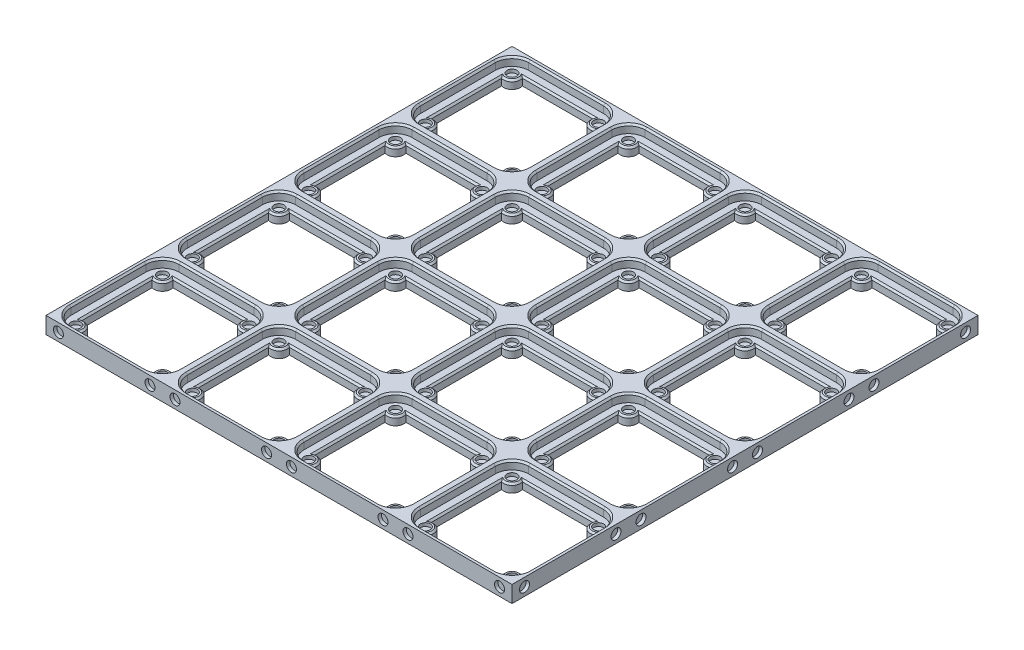
from build123d import *

# Parameters (mm, degrees)
SKETCH1_W           = 70
SKETCH1_H           = 70
BOSS_EXTRUDE2_DEPTH = 7
CUT_EXTRUDE1_DEPTH  = 5
SKETCH9_W           = 70
SKETCH9_H           = 70
BOSS_EXTRUDE3_DEPTH = 5
CUT_EXTRUDE11_DEPTH = 100.242128151
SKETCH21_R          = 3
CUT_EXTRUDE12_DEPTH = 2
CHAMFER3_SIZE       = 1
CUT_EXTRUDE13_START = -2
SKETCH22_W          = 70
SKETCH22_H          = 70
CUT_EXTRUDE13_DEPTH = 2
SKETCH23_R          = 3
CUT_EXTRUDE14_DEPTH = 2
SKETCH24_R          = 3
CUT_EXTRUDE15_DEPTH = 2
SKETCH25_R          = 3
BOSS_EXTRUDE4_DEPTH = 2


with BuildPart() as part:
    # Sketch1 → Boss-Extrude2 (new body)
    with BuildSketch(Plane(origin=(0, 0, 0), x_dir=(1, 0, 0), z_dir=(0, 1, 0))):
        with Locations((35, 35)):
            Rectangle(SKETCH1_W, SKETCH1_H)
    extrude(amount=BOSS_EXTRUDE2_DEPTH)

    # Sketch3 → Cut-Extrude1 (cut)
    with BuildSketch(Plane(origin=(0, 7, 0), x_dir=(1, 0, 0), z_dir=(0, 1, 0))):
        with BuildLine():
            Line((2.5, 57.5), (2.5, 12.5))
            ThreePointArc((2.5, 12.5), (5.428932188, 5.428932188), (12.5, 2.5))
            Line((12.5, 2.5), (57.5, 2.5))
            ThreePointArc((57.5, 2.5), (64.571067812, 5.428932188), (67.5, 12.5))
            Line((67.5, 12.5), (67.5, 57.5))
            ThreePointArc((67.5, 57.5), (64.571067812, 64.571067812), (57.5, 67.5))
            Line((57.5, 67.5), (12.5, 67.5))
            ThreePointArc((12.5, 67.5), (5.428932188, 64.571067812), (2.5, 57.5))
        make_face()
    extrude(amount=-CUT_EXTRUDE1_DEPTH, mode=Mode.SUBTRACT)

    # Sketch9 → Boss-Extrude3 (add)
    with BuildSketch(Plane.XZ):
        with Locations((35, -35)):
            Rectangle(SKETCH9_W, SKETCH9_H)
    extrude(amount=BOSS_EXTRUDE3_DEPTH)

    # Sketch20 → Cut-Extrude11 (cut, through all)
    with BuildSketch(Plane(origin=(0, 2, 0), x_dir=(1, 0, 0), z_dir=(0, 1, 0))):
        with BuildLine():
            Line((13.745191882, 7.5), (56.254808118, 7.5))
            ThreePointArc((56.254808118, 7.5), (57.5, 12.5), (62.5, 13.745191882))
            Line((62.5, 13.745191882), (62.5, 56.254808118))
            ThreePointArc((62.5, 56.254808118), (57.5, 57.5), (56.254808118, 62.5))
            Line((56.254808118, 62.5), (13.745191882, 62.5))
            ThreePointArc((13.745191882, 62.5), (12.5, 57.5), (7.5, 56.254808118))
            Line((7.5, 56.254808118), (7.5, 13.745191882))
            ThreePointArc((7.5, 13.745191882), (12.5, 12.5), (13.745191882, 7.5))
        make_face()
    extrude(amount=-CUT_EXTRUDE11_DEPTH, mode=Mode.SUBTRACT)

    # Sketch21 → Cut-Extrude12 (cut)
    with BuildSketch(Plane(origin=(0, 2, 0), x_dir=(1, 0, 0), z_dir=(0, 1, 0))):
        with Locations((8.964466094, 61.035533906)):
            Circle(SKETCH21_R)
        with Locations((61.035533906, 61.035533906)):
            Circle(SKETCH21_R)
        with Locations((61.035533906, 8.964466094)):
            Circle(SKETCH21_R)
        with Locations((8.964466094, 8.964466094)):
            Circle(SKETCH21_R)
    extrude(amount=-CUT_EXTRUDE12_DEPTH, mode=Mode.SUBTRACT)

    # Chamfer3
    chamfer3_edges = [part.edges().sort_by_distance(p)[0] for p in [
        (35, 7, -2.5),
        (64.571067812, 7, -5.428932188),
        (5.428932188, 7, -5.428932188),
        (67.5, 7, -35),
        (2.5, 7, -35),
        (64.571067812, 7, -64.571067812),
        (5.428932188, 7, -64.571067812),
        (35, 7, -67.5),
        (12.5, 2, -12.5),
        (35, 2, -7.5),
        (57.5, 2, -12.5),
        (62.5, 2, -35),
        (57.5, 2, -57.5),
        (7.5, 2, -35),
        (12.5, 2, -57.5),
        (35, 2, -62.5),
    ]]
    chamfer(chamfer3_edges, length=CHAMFER3_SIZE)

    # Sketch22 → Cut-Extrude13 (cut)
    with BuildSketch(Plane.XZ.offset(5).offset(CUT_EXTRUDE13_START)):
        with Locations((35, -35)):
            Rectangle(SKETCH22_W, SKETCH22_H)
        with BuildLine():
            Line((7.5, -13.745191882), (7.5, -56.254808118))
            ThreePointArc((7.5, -56.254808118), (12.5, -57.5), (13.745191882, -62.5))
            Line((13.745191882, -62.5), (56.254808118, -62.5))
            ThreePointArc((56.254808118, -62.5), (57.5, -57.5), (62.5, -56.254808118))
            Line((62.5, -56.254808118), (62.5, -13.745191882))
            ThreePointArc((62.5, -13.745191882), (57.5, -12.5), (56.254808118, -7.5))
            Line((56.254808118, -7.5), (13.745191882, -7.5))
            ThreePointArc((13.745191882, -7.5), (12.5, -12.5), (7.5, -13.745191882))
        make_face(mode=Mode.SUBTRACT)
    extrude(amount=CUT_EXTRUDE13_DEPTH, mode=Mode.SUBTRACT)

    # Sketch23 → Cut-Extrude14 (cut)
    with BuildSketch(Plane.ZY):
        with Locations((-62.5, 2)):
            Circle(SKETCH23_R)
        with Locations((-7.5, 2)):
            Circle(SKETCH23_R)
    extrude(amount=-CUT_EXTRUDE14_DEPTH, mode=Mode.SUBTRACT)

    # Mirror5: part across plane


with BuildPart() as part_1:
    add(part.part)
    add(part.part.mirror(Plane(origin=(0, 7, -70), x_dir=(1, 0, 0), z_dir=(0, 0, 1))))

    # Mirror6: part across plane


with BuildPart() as part_2:
    add(part_1.part)
    add(part_1.part.mirror(Plane(origin=(0, 7, -140), x_dir=(1, 0, 0), z_dir=(0, 0, 1))))

    # Sketch24 → Cut-Extrude15 (cut)
    with BuildSketch(Plane.XY):
        with Locations((7.5, 2)):
            Circle(SKETCH24_R)
        with Locations((62.5, 2)):
            Circle(SKETCH24_R)
    cut_extrude15 = extrude(amount=-CUT_EXTRUDE15_DEPTH, mode=Mode.SUBTRACT)

    # Mirror7: Cut-Extrude15 across plane
    add(cut_extrude15.mirror(Plane.XY.offset(-140)), mode=Mode.SUBTRACT)

    # Mirror9: part across plane


with BuildPart() as part_3:
    add(part_2.part)
    add(part_2.part.mirror(Plane(origin=(70, 7, 0), x_dir=(0, 0, 1), z_dir=(-1, 0, 0))))

    # Sketch25 → Boss-Extrude4 (add)
    with BuildSketch(Plane(origin=(138, 0, 0), x_dir=(0, 0, -1), z_dir=(1, 0, 0))):
        with Locations((7.5, 2)):
            Circle(SKETCH25_R)
        with Locations((62.5, 2)):
            Circle(SKETCH25_R)
        with Locations((77.5, 2)):
            Circle(SKETCH25_R)
        with Locations((132.5, 2)):
            Circle(SKETCH25_R)
        with Locations((272.5, 2)):
            Circle(SKETCH25_R)
        with Locations((217.5, 2)):
            Circle(SKETCH25_R)
        with Locations((202.5, 2)):
            Circle(SKETCH25_R)
        with Locations((147.5, 2)):
            Circle(SKETCH25_R)
    extrude(amount=BOSS_EXTRUDE4_DEPTH)

    # Mirror10: part across plane


with BuildPart() as part_4:
    add(part_3.part)
    add(part_3.part.mirror(Plane(origin=(140, 7, 0), x_dir=(0, 0, 1), z_dir=(-1, 0, 0))))


solid = part_4.part
